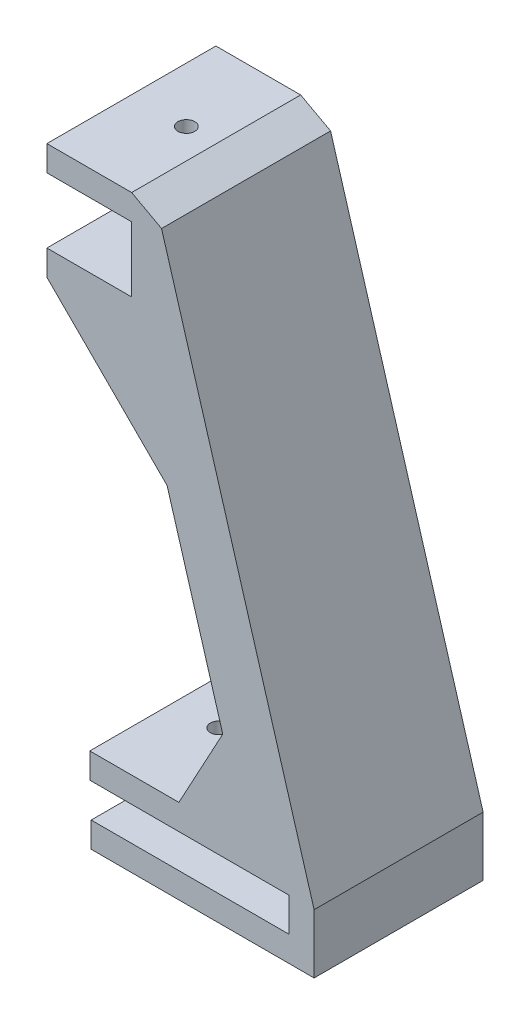
from build123d import *
from OCP.BRepFilletAPI import BRepFilletAPI_MakeChamfer

# Parameters (mm, degrees)
BOSS_EXTRUDE1_DEPTH = 20
CHAMFER1_SIZE       = 10
CHAMFER1_SIZE_2     = 14.838658038
CHAMFER1_SIZE_3     = 8.042998795
SKETCH2_R           = 1
CUT_EXTRUDE1_DEPTH  = 22
SKETCH3_R           = 1
CUT_EXTRUDE2_DEPTH  = 22
CHAMFER2_SIZE       = 2
CHAMFER2_SIZE2      = 2.967731608


with BuildPart() as part:
    # Sketch1 → Boss-Extrude1 (new body)
    with BuildSketch(Plane.XY):
        Polygon((0, 0), (23.377026873, 0), (23.377026873, 4), (-0.166134072, 4), (-0.166134072, 7), (4.755655282, 7), (18.417267614, 7), (4.755655282, 53), (-5.244344718, 53), (-5.244344718, 56), (4.755655282, 56), (4.755655282, 63.7), (-5.244344718, 63.7), (-5.244344718, 66.7), (7.755655282, 66.7), (26.377026873, 4), (26.377026873, -3), (0, -3), align=None)
    extrude(amount=BOSS_EXTRUDE1_DEPTH)

    # Chamfer1
    chamfer1_edges_1 = [part.edges().sort_by_distance(p)[0] for p in [
        (4.755655282, 53, 10),
    ]]
    chamfer1_side_1 = [part.faces().sort_by_distance(p)[0] for p in [
        (4.555655282, 53, 10),
    ]]
    chamfer1_edges_2 = [part.edges().sort_by_distance(p)[0] for p in [
        (18.417267614, 7, 10),
    ]]
    chamfer1_side_2 = [part.faces().sort_by_distance(p)[0] for p in [
        (18.37147062, 7.154203007, 10),
    ]]
    chamfer1 = BRepFilletAPI_MakeChamfer(part.part.solid().wrapped)
    for e in chamfer1_edges_1:
        chamfer1.Add(CHAMFER1_SIZE - 0.0001, CHAMFER1_SIZE_2 - 0.0001, e.wrapped, chamfer1_side_1[0].wrapped)
    for e in chamfer1_edges_2:
        chamfer1.Add(CHAMFER1_SIZE - 0.0001, CHAMFER1_SIZE_3 - 0.0001, e.wrapped, chamfer1_side_2[0].wrapped)
    add(Compound.cast(chamfer1.Shape()), mode=Mode.REPLACE)  # a hair under: the kernel refuses the full size

    # Sketch2 → Cut-Extrude1 (cut)
    with BuildSketch(Plane(origin=(0, 66.7, 0), x_dir=(1, 0, 0), z_dir=(0, 1, 0))):
        with Locations(Location((1.255655282, -10, 0), (0, 0, 180))):
            Circle(SKETCH2_R)
    extrude(amount=-CUT_EXTRUDE1_DEPTH, mode=Mode.SUBTRACT)

    # Sketch3 → Cut-Extrude2 (cut)
    with BuildSketch(Plane(origin=(0, 7, 0), x_dir=(1, 0, 0), z_dir=(0, 1, 0))):
        with Locations(Location((5.104067373, -10, 0), (0, 0, 270))):
            Circle(SKETCH3_R)
    extrude(amount=-CUT_EXTRUDE2_DEPTH, mode=Mode.SUBTRACT)

    # Chamfer2
    chamfer2_edges = [part.edges().sort_by_distance(p)[0] for p in [
        (7.755655282, 66.7, 10),
    ]]
    chamfer2_side = [part.faces().sort_by_distance(p)[0] for p in [
        (17.066341078, 35.35, 10),
    ]]
    chamfer(chamfer2_edges, length=CHAMFER2_SIZE, length2=CHAMFER2_SIZE2, reference=chamfer2_side[0])


solid = part.part
